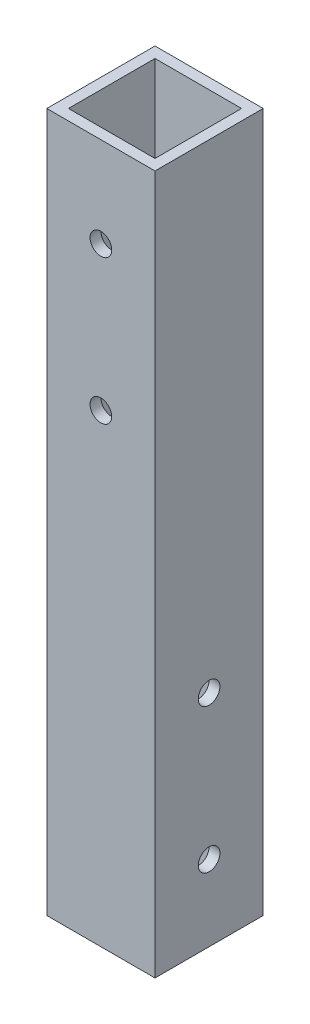
from build123d import *

# Parameters (mm, degrees)
SKETCH_1_W              = 15
SKETCH_1_H              = 15
SKETCH_1_W_2            = 12
SKETCH_1_H_2            = 12
EXTRUDE_1_DEPTH         = 96.9
SKETCH_2_R              = 1.5
CUT_EXTRUDE_1_DEPTH     = 100.194808332
CUT_EXTRUDE_2_OUTLINE_R = 1.5
CUT_EXTRUDE_2_DEPTH     = 15


# Read off the part's stored shape, not the designer's step: 切除-拉伸2
with BuildPart() as part:
    # 草图1 → 凸台-拉伸1 (new body)
    with BuildSketch(Plane(origin=(0, 0, 0), x_dir=(1, 0, 0), z_dir=(0, 1, 0))):
        with Locations((7.5, 7.5)):
            Rectangle(SKETCH_1_W, SKETCH_1_H)
        with Locations((7.5, 7.5)):
            Rectangle(SKETCH_1_W_2, SKETCH_1_H_2, mode=Mode.SUBTRACT)
    extrude(amount=EXTRUDE_1_DEPTH)

    # 草图2 (on Front Plane) → 切除-拉伸1 (cut, through all)
    with BuildSketch(Plane.XY):
        with Locations((7.5, 64.4)):
            Circle(SKETCH_2_R)
        with Locations((7.5, 84.4)):
            Circle(SKETCH_2_R)
    extrude(amount=-CUT_EXTRUDE_1_DEPTH, mode=Mode.SUBTRACT)

    # 切除-拉伸2 outline → 切除-拉伸2 (cut)
    with BuildSketch(Plane.YZ):
        with Locations((10.5, -7.5)):
            Circle(CUT_EXTRUDE_2_OUTLINE_R)
        with Locations((30.5, -7.5)):
            Circle(CUT_EXTRUDE_2_OUTLINE_R)
    extrude(amount=CUT_EXTRUDE_2_DEPTH, mode=Mode.SUBTRACT)


solid = part.part
